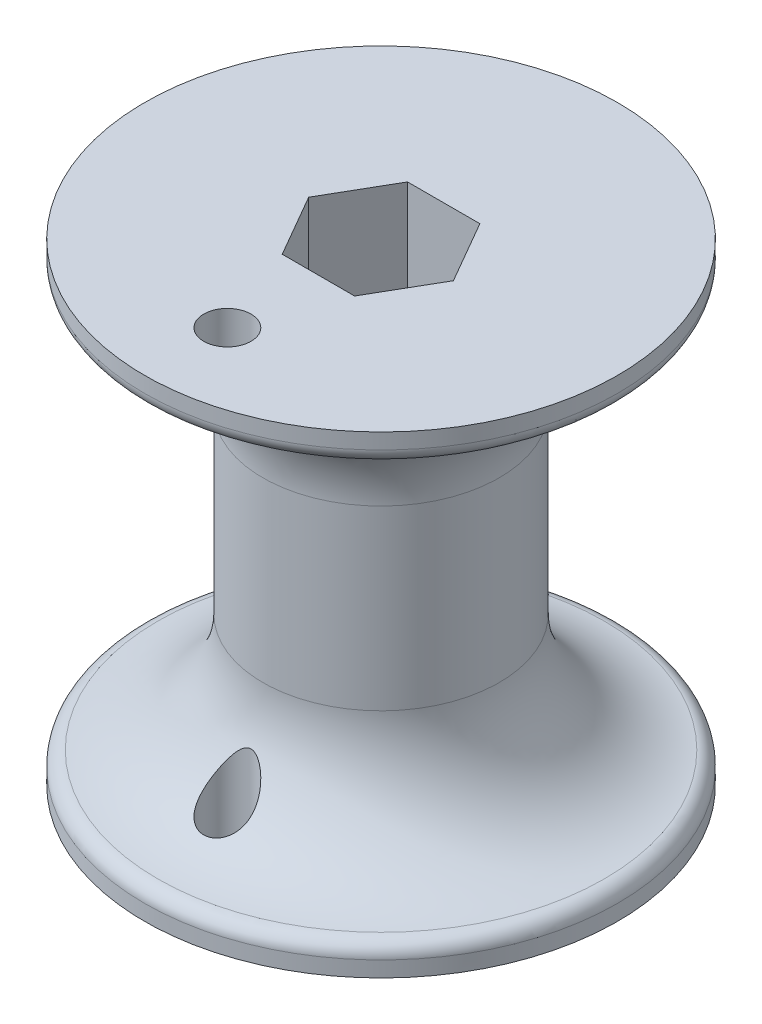
from build123d import *

# Parameters (mm, degrees)
SKETCH2_R          = 2.54
CUT_EXTRUDE1_DEPTH = 63.217039467
FILLET1_R          = 1.5875


with BuildPart() as part:
    # Sketch1 → Revolve1 (revolve)
    with BuildSketch(Plane(origin=(0, 0, 0), x_dir=(0, 0, -1), z_dir=(1, 0, 0))):
        with BuildLine():
            Line((0, 0), (0, 25.4))
            Line((0, 25.4), (25.4, 25.4))
            Line((25.4, 25.4), (25.4, 22.225))
            ThreePointArc((25.4, 22.225), (16.419743879, 18.505256121), (12.7, 9.525))
            Line((12.7, 9.525), (12.7, 0))
            Line((12.7, 0), (0, 0))
        make_face()
    revolve1 = revolve(axis=Axis((0, 0, 0), (0, 1, 0)))

    # Mirror1: Revolve1 across plane
    add(revolve1.mirror(Plane(origin=(0, 0, -12.7), x_dir=(0, 0, 1), z_dir=(0, -1, 0))))

    # Sketch2 → Cut-Extrude1 (cut, through all)
    with BuildSketch(Plane(origin=(0, 25.4, 0), x_dir=(1, 0, 0), z_dir=(0, 1, 0))):
        with Locations((0, -16.51)):
            Circle(SKETCH2_R)
        Polygon((-3.886144662, -6.731), (3.886144662, -6.731), (7.772289324, 0), (3.886144662, 6.731), (-3.886144662, 6.731), (-7.772289324, 0), align=None)
    extrude(amount=-CUT_EXTRUDE1_DEPTH, mode=Mode.SUBTRACT)

    # Fillet1
    fillet1_edges = [part.edges().sort_by_distance(p)[0] for p in [
        (0, -22.225, 25.4),
        (0, 22.225, 25.4),
    ]]
    fillet(fillet1_edges, radius=FILLET1_R)


solid = part.part
